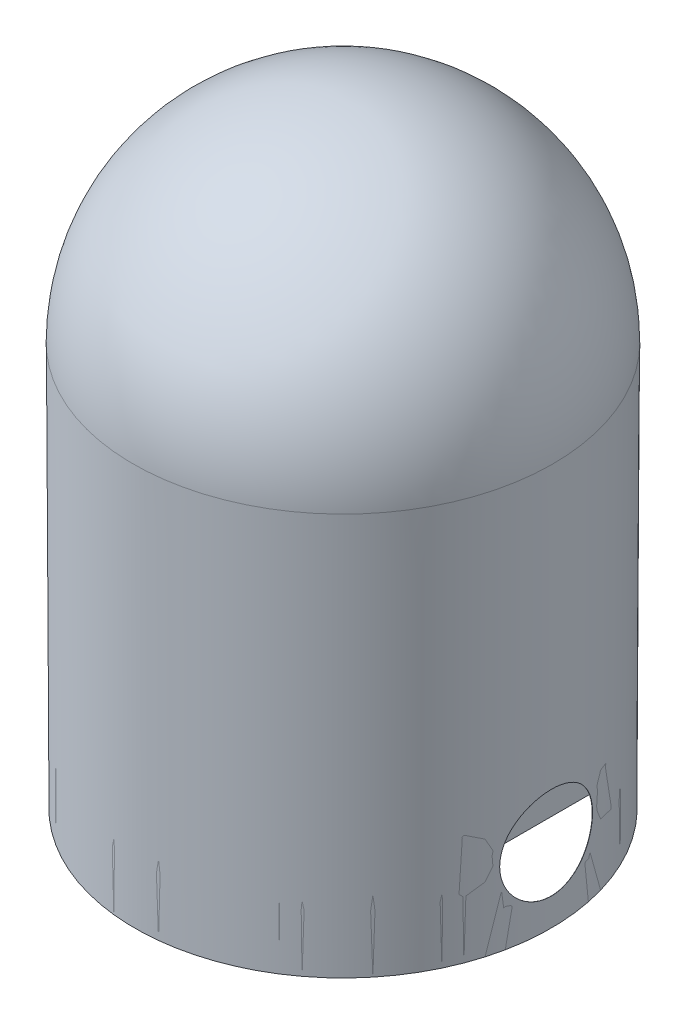
from build123d import *

# Parameters (mm, degrees)
CUT_EXTRUDE1_DEPTH = 10.16
SKETCH3_R          = 3.175
CUT_EXTRUDE2_DEPTH = 50.44819655


with BuildPart() as part:
    # Sketch1 → Revolve1 (revolve)
    with BuildSketch(Plane.XY):
        with BuildLine():
            Line((0, 0), (0, 5.602635041))
            Line((0, 5.602635041), (-2.54, 5.602635041))
            Line((-2.54, 5.602635041), (-2.54, 22.86))
            ThreePointArc((-2.54, 22.86), (-5.178424667, 28.869007239), (0, 32.900554175))
            Line((0, 32.900554175), (0, 41.91))
            ThreePointArc((0, 41.91), (-10.147689417, 37.706689417), (-14.351, 27.559))
            Line((-14.351, 27.559), (-14.224, 0))
            Line((-14.224, 0), (0, 0))
        make_face()
    revolve(axis=Axis((0, 0, 0), (0, 1, 0)))

    # Sketch2 → Cut-Extrude1 (cut)
    with BuildSketch(Plane.XZ):
        with BuildLine():
            Line((-2.54, 13.995376951), (-2.54, -13.995376951))
            ThreePointArc((-2.54, -13.995376951), (0, -14.224), (2.54, -13.995376951))
            Line((2.54, -13.995376951), (2.54, 13.995376951))
            ThreePointArc((2.54, 13.995376951), (0, 14.224), (-2.54, 13.995376951))
        make_face()
        with BuildLine():
            Line((-7.62, 12.010735864), (-7.62, -12.010735864))
            ThreePointArc((-7.62, -12.010735864), (-14.224, 0), (-7.62, 12.010735864))
        make_face()
        with BuildLine():
            Line((7.62, 12.010735864), (7.62, -12.010735864))
            ThreePointArc((7.62, -12.010735864), (14.224, 0), (7.62, 12.010735864))
        make_face()
    extrude(amount=-CUT_EXTRUDE1_DEPTH, mode=Mode.SUBTRACT)

    # Sketch3 → Cut-Extrude2 (cut, through all)
    with BuildSketch(Plane.ZY.offset(7.62)):
        with Locations((0, 5.08)):
            Circle(SKETCH3_R)
    extrude(amount=-CUT_EXTRUDE2_DEPTH, mode=Mode.SUBTRACT)


solid = part.part
